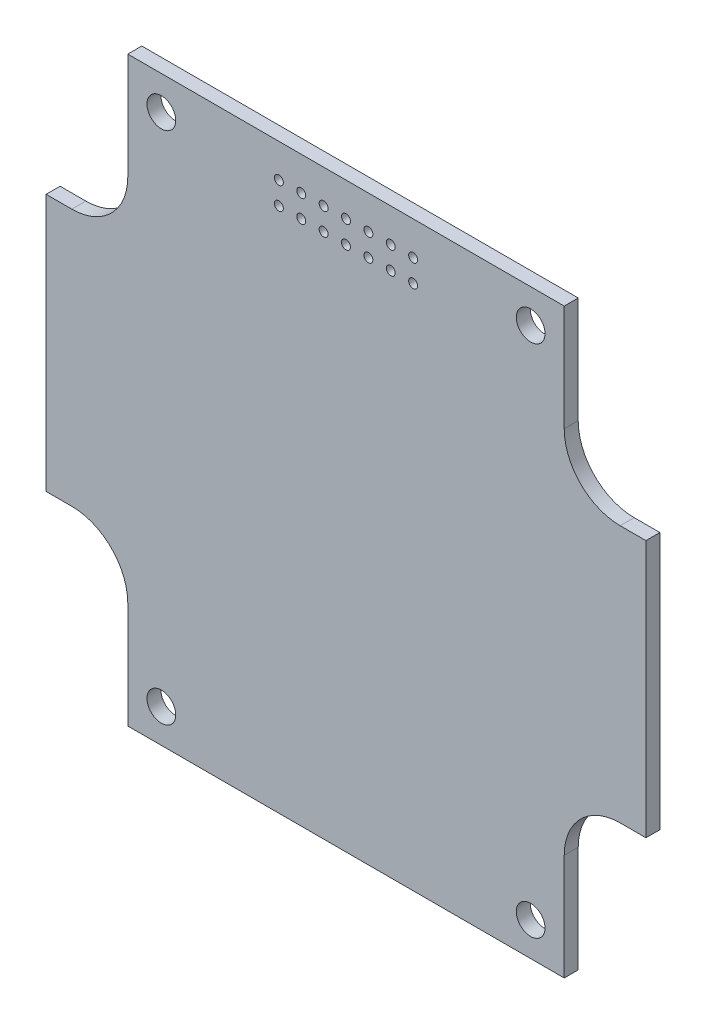
from build123d import *

# Parameters (mm, degrees)
BOSS_EXTRUDE1_DEPTH = 1.5875
SKETCH3_R           = 1.63195
CUT_EXTRUDE1_DEPTH  = 95.855674265
SKETCH4_R           = 0.508
CUT_EXTRUDE2_DEPTH  = 95.855674265


with BuildPart() as part:
    # Sketch1 → Boss-Extrude1 (new body)
    with BuildSketch(Plane.XY):
        with BuildLine():
            Line((0, 47.625), (0, 18.415))
            Line((0, 18.415), (2.921, 18.415))
            ThreePointArc((2.921, 18.415), (7.411128061, 16.555128061), (9.271, 12.065))
            Line((9.271, 12.065), (9.271, 0))
            Line((9.271, 0), (58.801, 0))
            Line((58.801, 0), (58.801, 12.065))
            ThreePointArc((58.801, 12.065), (60.660871939, 16.555128061), (65.151, 18.415))
            Line((65.151, 18.415), (68.072, 18.415))
            Line((68.072, 18.415), (68.072, 47.625))
            Line((68.072, 47.625), (65.151, 47.625))
            ThreePointArc((65.151, 47.625), (60.660871939, 49.484871939), (58.801, 53.975))
            Line((58.801, 53.975), (58.801, 66.04))
            Line((58.801, 66.04), (9.271, 66.04))
            Line((9.271, 66.04), (9.271, 53.975))
            ThreePointArc((9.271, 53.975), (7.411128061, 49.484871939), (2.921, 47.625))
            Line((2.921, 47.625), (0, 47.625))
        make_face()
    extrude(amount=BOSS_EXTRUDE1_DEPTH)

    # Sketch3 → Cut-Extrude1 (cut, through all)
    with BuildSketch(Plane.XY.offset(1.5875)):
        with Locations((13.081, 62.23)):
            Circle(SKETCH3_R)
        with Locations((54.991, 62.23)):
            Circle(SKETCH3_R)
        with Locations((54.991, 3.81)):
            Circle(SKETCH3_R)
        with Locations((13.081, 3.81)):
            Circle(SKETCH3_R)
    extrude(amount=-CUT_EXTRUDE1_DEPTH, mode=Mode.SUBTRACT)

    # Sketch4 → Cut-Extrude2 (cut, through all)
    with BuildSketch(Plane.XY.offset(1.5875)):
        with Locations((34.036, 62.23)):
            Circle(SKETCH4_R)
        with Locations((36.576, 62.23)):
            Circle(SKETCH4_R)
        with Locations((39.116, 62.23)):
            Circle(SKETCH4_R)
        with Locations((41.656, 62.23)):
            Circle(SKETCH4_R)
        with Locations((36.576, 59.69)):
            Circle(SKETCH4_R)
        with Locations((39.116, 59.69)):
            Circle(SKETCH4_R)
        with Locations((41.656, 59.69)):
            Circle(SKETCH4_R)
        with Locations((34.036, 59.69)):
            Circle(SKETCH4_R)
        with Locations((31.496, 62.23)):
            Circle(SKETCH4_R)
        with Locations((28.956, 62.23)):
            Circle(SKETCH4_R)
        with Locations((26.416, 62.23)):
            Circle(SKETCH4_R)
        with Locations((31.496, 59.69)):
            Circle(SKETCH4_R)
        with Locations((28.956, 59.69)):
            Circle(SKETCH4_R)
        with Locations((26.416, 59.69)):
            Circle(SKETCH4_R)
    extrude(amount=-CUT_EXTRUDE2_DEPTH, mode=Mode.SUBTRACT)


solid = part.part
